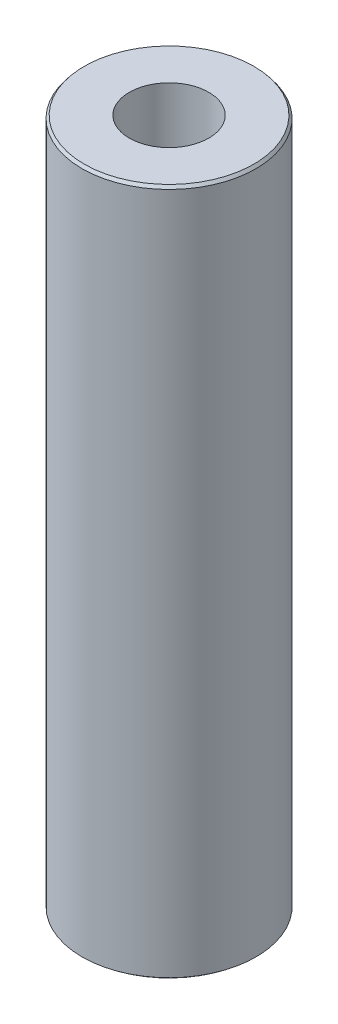
from build123d import *
from OCP.BRepFilletAPI import BRepFilletAPI_MakeChamfer

# Parameters (mm, degrees)
SKETCH1_R           = 50
BOSS_EXTRUDE1_DEPTH = 395.22319632
SKETCH2_R           = 22.840280895
CUT_EXTRUDE1_DEPTH  = 402.498910222
CHAMFER1_SIZE       = 1.609825388
CHAMFER1_SIZE2      = 1.262184848


with BuildPart() as part:
    # Sketch1 → Boss-Extrude1 (new body)
    with BuildSketch(Plane(origin=(0, 0, 0), x_dir=(1, 0, 0), z_dir=(0, 1, 0))):
        Circle(SKETCH1_R)
    extrude(amount=BOSS_EXTRUDE1_DEPTH)

    # Sketch2 → Cut-Extrude1 (cut, through all)
    with BuildSketch(Plane(origin=(0, 0, 0), x_dir=(1, 0, 0), z_dir=(0, 1, 0))):
        Circle(SKETCH2_R)
    extrude(amount=CUT_EXTRUDE1_DEPTH, mode=Mode.SUBTRACT)

    # Chamfer1: one chamfer whose edges measure the first distance from different faces: ONE call of the kernel's chamfer builder (chamfer() names one face for all edges)
    chamfer1_edges_1 = [part.edges().sort_by_distance(p)[0] for p in [
        (-50, 395.22319632, 0),
    ]]
    chamfer1_side_1 = [part.faces().sort_by_distance(p)[0] for p in [
        (-50, 197.61159816, 0),
    ]]
    chamfer1_edges_2 = [part.edges().sort_by_distance(p)[0] for p in [
        (-50, 0, 0),
    ]]
    chamfer1_side_2 = [part.faces().sort_by_distance(p)[0] for p in [
        (-48.585786438, 0, 0),
    ]]
    chamfer1 = BRepFilletAPI_MakeChamfer(part.part.solid().wrapped)
    for e in chamfer1_edges_1:
        chamfer1.Add(CHAMFER1_SIZE, CHAMFER1_SIZE2, e.wrapped, chamfer1_side_1[0].wrapped)  # the first distance lies on this face
    for e in chamfer1_edges_2:
        chamfer1.Add(CHAMFER1_SIZE, CHAMFER1_SIZE2, e.wrapped, chamfer1_side_2[0].wrapped)  # the first distance lies on this face
    add(Compound.cast(chamfer1.Shape()), mode=Mode.REPLACE)


solid = part.part
